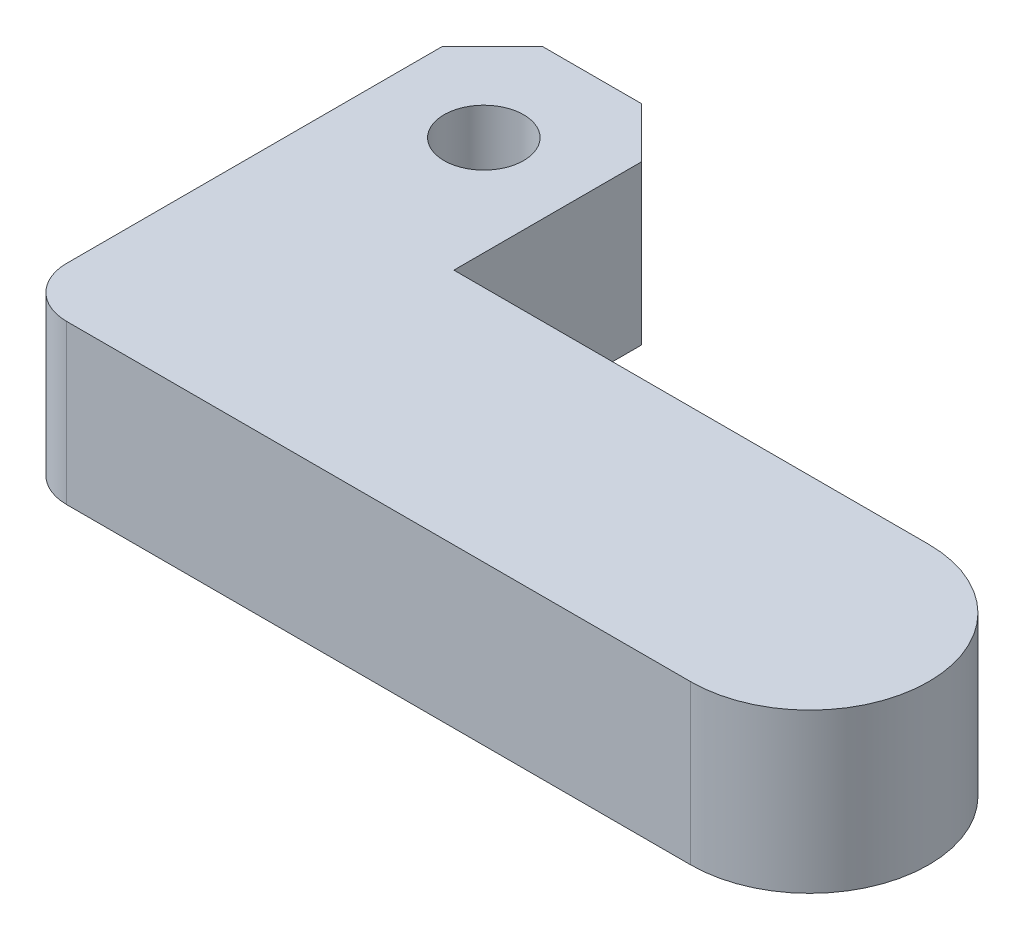
from build123d import *

# Parameters (mm, degrees)
SKETCH1_R           = 2.50825
BOSS_EXTRUDE1_DEPTH = 10
FILLET1_R           = 3.175
CHAMFER1_SIZE       = 3.175


with BuildPart() as part:
    # Sketch1 → Boss-Extrude1 (new body)
    with BuildSketch(Plane(origin=(0, 0, 0), x_dir=(1, 0, 0), z_dir=(0, 1, 0))):
        with BuildLine():
            Line((0, 30), (0, 0))
            Line((0, 0), (42.5, 0))
            ThreePointArc((42.5, 0), (50, 7.5), (42.5, 15))
            Line((42.5, 15), (12.573, 15))
            Line((12.573, 15), (12.573, 30))
            Line((12.573, 30), (0, 30))
        make_face()
        with Locations((6.2865, 23.175)):
            Circle(SKETCH1_R, mode=Mode.SUBTRACT)
    extrude(amount=BOSS_EXTRUDE1_DEPTH)

    # Fillet1
    fillet1_edges = [part.edges().sort_by_distance(p)[0] for p in [
        (0, 5, 0),
    ]]
    fillet(fillet1_edges, radius=FILLET1_R)

    # Chamfer1
    chamfer1_edges = [part.edges().sort_by_distance(p)[0] for p in [
        (0, 5, -30),
        (12.573, 5, -30),
    ]]
    chamfer(chamfer1_edges, length=CHAMFER1_SIZE)


solid = part.part
